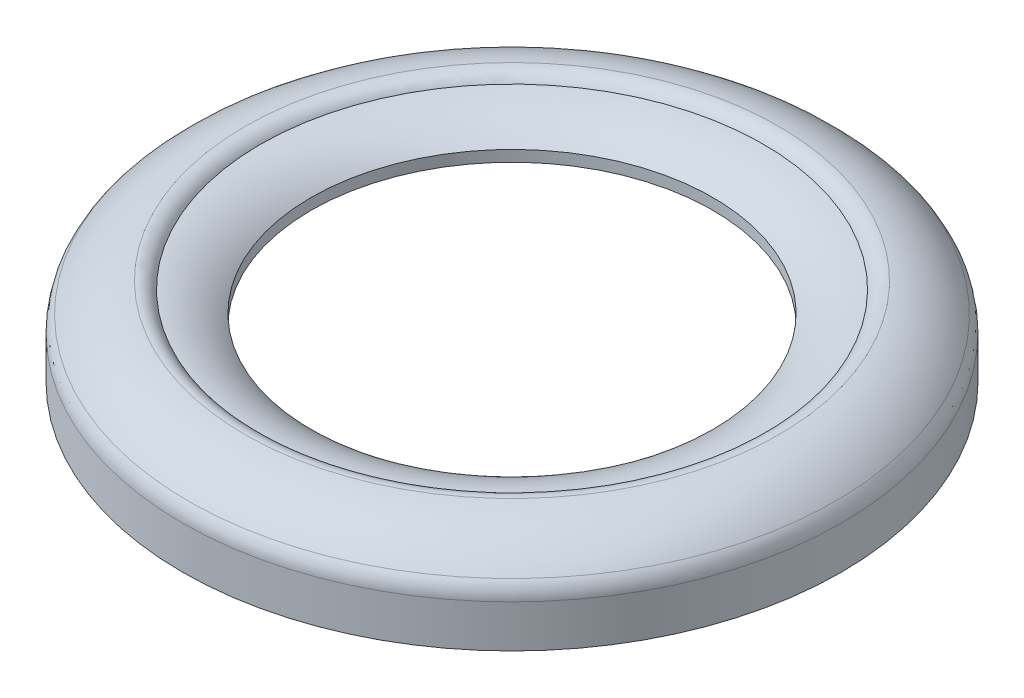
from build123d import *

# Parameters (mm, degrees)
FILLET_1_R = 1
FILLET_2_R = 0.5
SHELL_1_T  = 0.5


with BuildPart() as part:
    # Эскиз1 → Повернуть1 (revolve)
    with BuildSketch(Plane.XY):
        with BuildLine():
            Line((-20, -2.45e-15), (-20, 2.9999999999999973))
            ThreePointArc((-20, 2.9999999999999973), (-18.23606797749979, 4.47213595499958), (-16, 5.000000000000001))
            Line((-16, 5.000000000000001), (-16, 4.500000000000001))
            ThreePointArc((-16, 4.500000000000001), (-14.096056723534023, 4.1092009784206125), (-12.5, 2.9999999999999973))
            Line((-12.5, 2.9999999999999973), (-12.5, -1.53e-15))
            Line((-12.5, -1.53e-15), (-20, -2.45e-15))
        make_face()
    revolve(axis=Axis((8.7e-16, 5, 0), (-1.7e-16, -1, 0)))

    # Скругление1
    fillet_1_edges = [part.edges().sort_by_distance(p)[0] for p in [
        (20, 2.99999999999999, -2.45e-15),
    ]]
    fillet(fillet_1_edges, radius=FILLET_1_R)

    # Скругление2
    # the kernel refuses this fillet: 0.5 mm, written as the material it takes off along each edge
    with BuildSketch(Plane(origin=(8.7e-16, 4.999999999999999, 0), x_dir=(-1, 1.7e-16, 0), z_dir=(0, 0, 1))) as fillet_2_piece_1:
        with BuildLine():
            CenterArc((16.499227798766984, 0.5277777777777778), FILLET_2_R, 183.1847385367202, 93.18473853672054)
            Line((16, 0.5000000000000018), (15.99001544402466, 0.49944444444444613))
            ThreePointArc((15.99001544402466, 0.49944444444444613), (15.99, 0.2500000000000009), (15.99, 0))
            Line((15.99, 0), (16, -0.00999999999999979))
            ThreePointArc((16, -0.00999999999999979), (16.278333333333332, -0.00226254364518126), (16.55580694929391, 0.02092592592592544))
            Line((16.55580694929391, 0.02092592592592544), (16.554697554185537, 0.03086419753086398))
        make_face()
    revolve(axis=Axis((8.7e-16, 4.999999999999999, 0), (-1.7e-16, -1, 0)), mode=Mode.SUBTRACT)

    # Оболочка1
    shell_1_openings = [part.faces().sort_by_distance(p)[0] for p in [
        (13.065685425, 0, 0),
        (12.5, 1.5, 0),
    ]]
    offset(amount=SHELL_1_T, openings=shell_1_openings, kind=Kind.INTERSECTION)


solid = part.part
